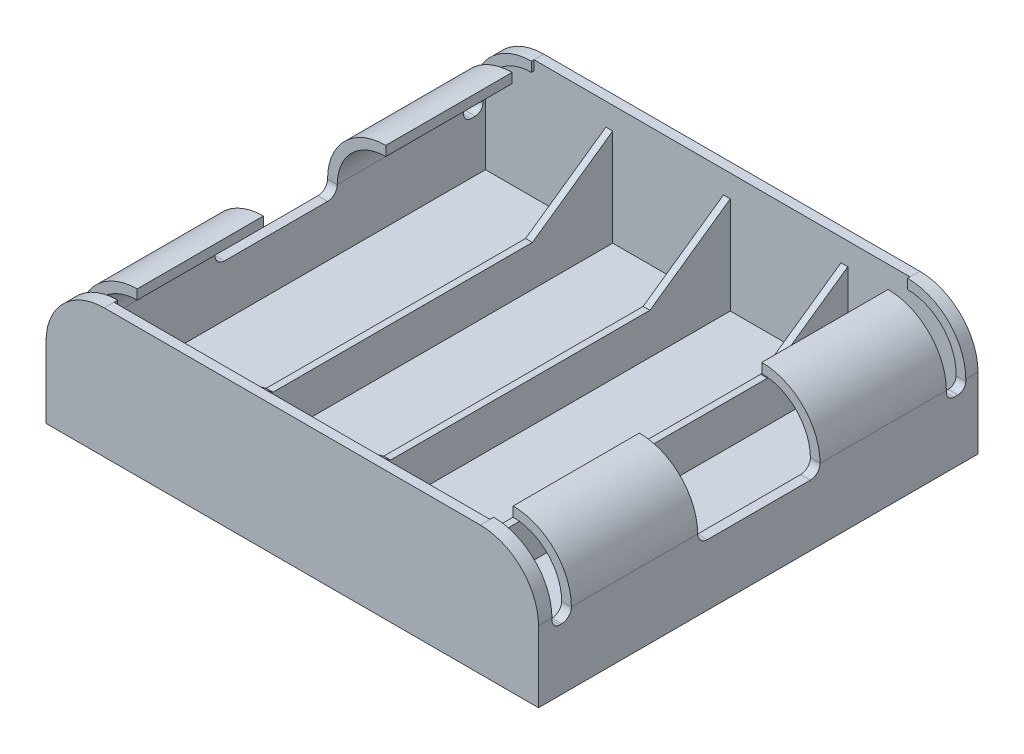
from build123d import *

# Parameters (mm, degrees)
SKETCH1_W               = 64.389
SKETCH1_H               = 16.891
EXTRUDE1_DEPTH          = 57.4548
FILLET2_R               = 7.62
SHELL1_START            = 1.27
SHELL1_DEPTH            = 54.9148
CUT_EXTRUDE1_DEPTH      = 100.578641885
CUT_EXTRUDE1_DEPTH_BACK = 100.578641885
SKETCH4_W               = 0.889
SKETCH4_H               = 54.9148
EXTRUDE2_DEPTH          = 12.7
CUT_EXTRUDE2_DEPTH      = 20.32
CUT_EXTRUDE2_DEPTH_BACK = 19.05


# Read off the part's stored shape, not the designer's step: Shell1
with BuildPart() as part:
    # Sketch1 → Extrude1 (new body)
    with BuildSketch(Plane.XY):
        with Locations((-41.310464395, 26.366453204)):
            Rectangle(SKETCH1_W, SKETCH1_H)
    extrude(amount=EXTRUDE1_DEPTH)

    # Fillet2
    fillet2_edges = [part.edges().sort_by_distance(p)[0] for p in [
        (-73.504964395, 34.811953204, 28.7274),
        (-9.115964395, 34.811953204, 28.7274),
    ]]
    fillet(fillet2_edges, radius=FILLET2_R)

    # Shell1 outline → Shell1 (cut)
    with BuildSketch(Plane.XY.offset(SHELL1_START)):
        with BuildLine():
            Line((-16.735964395, 33.541953204), (-16.735964395, 34.811953204))
            Line((-16.735964395, 34.811953204), (-65.884964395, 34.811953204))
            Line((-65.884964395, 34.811953204), (-65.884964395, 33.541953204))
            ThreePointArc((-65.884964395, 33.541953204), (-70.375092455, 31.682081264), (-72.234964395, 27.191953204))
            Line((-72.234964395, 27.191953204), (-72.234964395, 19.190953204))
            Line((-72.234964395, 19.190953204), (-10.385964395, 19.190953204))
            Line((-10.385964395, 19.190953204), (-10.385964395, 27.191953204))
            ThreePointArc((-10.385964395, 27.191953204), (-12.245836334, 31.682081265), (-16.735964395, 33.541953204))
        make_face()
    extrude(amount=SHELL1_DEPTH, mode=Mode.SUBTRACT)

    # Sketch2 → Cut-Extrude1 (cut, two sides: drawn at the far end of the back side and taken through both)
    with BuildSketch(Plane(origin=(0, 0, 0), x_dir=(0, 0, -1), z_dir=(1, 0, 0)).offset(-CUT_EXTRUDE1_DEPTH_BACK)):
        with BuildLine():
            Line((-189.674707518, 34.811953204), (-58.293, 34.811953204))
            Line((-58.293, 34.811953204), (-55.698725793, 34.811953204))
            Line((-55.698725793, 34.811953204), (-55.698725793, 26.937953204))
            ThreePointArc((-55.698725793, 26.937953204), (-55.401146283, 26.219532715), (-54.682725793, 25.921953204))
            Line((-54.682725793, 25.921953204), (-54.428725793, 25.921953204))
            ThreePointArc((-54.428725793, 25.921953204), (-53.530700181, 26.293927592), (-53.158725793, 27.191953204))
            Line((-53.158725793, 27.191953204), (-53.158725793, 34.811953204))
            Line((-53.158725793, 34.811953204), (-36.648725793, 34.811953204))
            Line((-36.648725793, 34.811953204), (-36.648725793, 27.191953204))
            ThreePointArc((-36.648725793, 27.191953204), (-36.276751405, 26.293927592), (-35.378725793, 25.921953204))
            Line((-35.378725793, 25.921953204), (-21.916725793, 25.921953204))
            ThreePointArc((-21.916725793, 25.921953204), (-21.018700181, 26.293927592), (-20.646725793, 27.191953204))
            Line((-20.646725793, 27.191953204), (-20.646725793, 34.811953204))
            Line((-20.646725793, 34.811953204), (-4.136725793, 34.811953204))
            Line((-4.136725793, 34.811953204), (-4.136725793, 26.937953204))
            ThreePointArc((-4.136725793, 26.937953204), (-3.839146283, 26.219532715), (-3.120725793, 25.921953204))
            Line((-3.120725793, 25.921953204), (-2.612725793, 25.921953204))
            ThreePointArc((-2.612725793, 25.921953204), (-1.894305303, 26.219532715), (-1.596725793, 26.937953204))
            Line((-1.596725793, 26.937953204), (-1.596725793, 34.811953204))
            Line((-1.596725793, 34.811953204), (0, 34.811953204))
            Line((0, 34.811953204), (131.381707518, 34.811953204))
            Line((131.381707518, 34.811953204), (131.381707518, 297.575368241))
            Line((131.381707518, 297.575368241), (-189.674707518, 297.575368241))
            Line((-189.674707518, 297.575368241), (-189.674707518, 34.811953204))
        make_face()
    extrude(amount=CUT_EXTRUDE1_DEPTH + CUT_EXTRUDE1_DEPTH_BACK, mode=Mode.SUBTRACT)

    # Sketch4 → Extrude2 (add)
    with BuildSketch(Plane(origin=(0, 19.190953204, 0), x_dir=(-1, 0, 0), z_dir=(0, 1, 0))):
        with Locations((40.675464395, 28.7274)):
            Rectangle(SKETCH4_W, SKETCH4_H)
        with Locations((25.308464395, 28.7274)):
            Rectangle(SKETCH4_W, SKETCH4_H)
        with Locations((56.042464395, 28.7274)):
            Rectangle(SKETCH4_W, SKETCH4_H)
    extrude(amount=EXTRUDE2_DEPTH)

    # Sketch5 → Cut-Extrude2 (cut, two sides: drawn at the far end of the back side and taken through both)
    with BuildSketch(Plane.ZY.offset(41.119964395).offset(-CUT_EXTRUDE2_DEPTH_BACK)):
        Polygon((1.27, 31.890953204), (11.7729, 24.524953204), (45.6819, 24.524953204), (56.1848, 31.890953204), align=None)
    extrude(amount=CUT_EXTRUDE2_DEPTH + CUT_EXTRUDE2_DEPTH_BACK, mode=Mode.SUBTRACT)


solid = part.part
